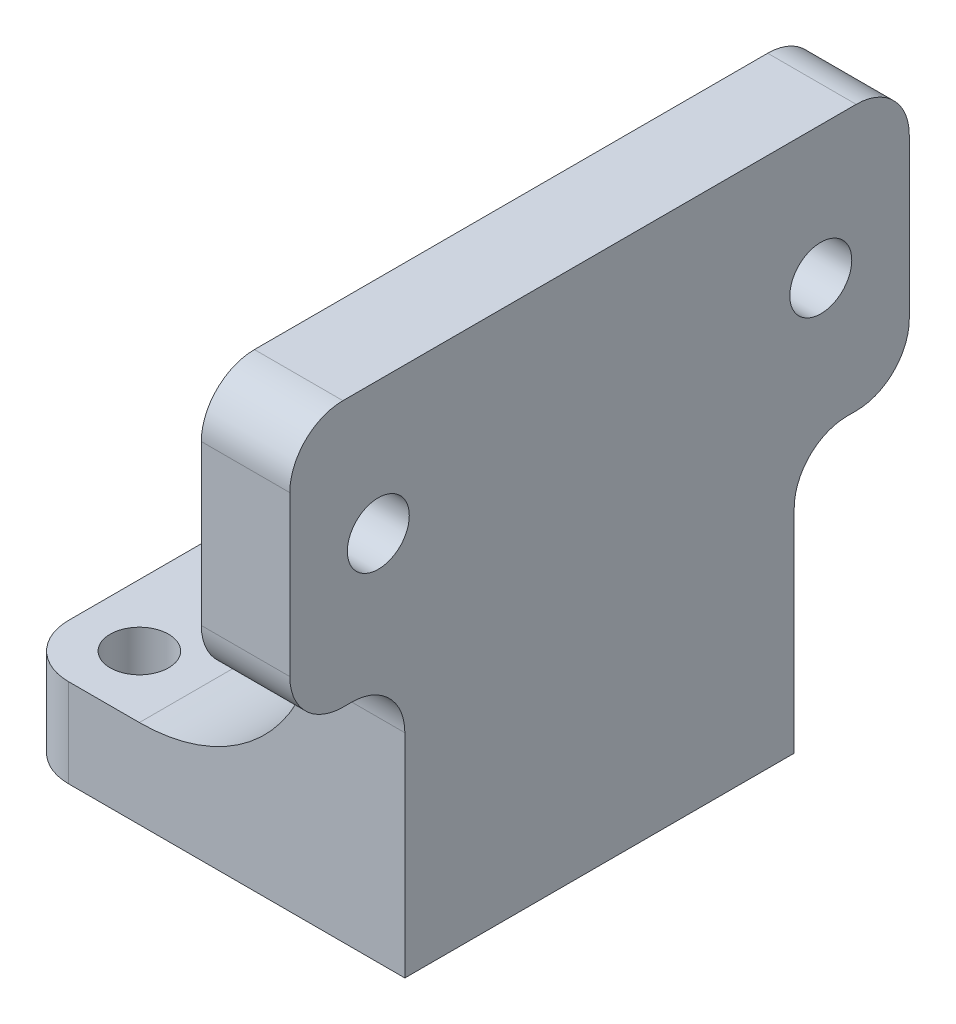
from build123d import *

# Parameters (mm, degrees)
SKETCH1_W                = 22
SKETCH1_H                = 22
SKETCH1_R                = 1.65
BOSS_EXTRUDE1_DEPTH      = 5
SKETCH2_W                = 5
SKETCH2_H                = 22
BOSS_EXTRUDE2_DEPTH      = 10
SKETCH3_W                = 7
SKETCH3_H                = 10
CUT_EXTRUDE1_DEPTH       = 0.1
FILLET1_R                = 10
SKETCH5_W                = 35
SKETCH5_H                = 15
SKETCH5_R                = 1.75
CHANGE_THIS_SKETCH_DEPTH = 5
FILLET2_R                = 3


with BuildPart() as part:
    # Sketch1 → Boss-Extrude1 (new body)
    with BuildSketch(Plane(origin=(0, 0, 0), x_dir=(1, 0, 0), z_dir=(0, 1, 0))):
        with Locations((11, 11)):
            Rectangle(SKETCH1_W, SKETCH1_H)
        with Locations(Location((13.5, 11, 0), (0, 0, 270))):
            Circle(SKETCH1_R, mode=Mode.SUBTRACT)
        with Locations(Location((3.5, 3.5, 0), (0, 0, 270))):
            Circle(SKETCH1_R, mode=Mode.SUBTRACT)
        with Locations(Location((3.5, 18.5, 0), (0, 0, 90))):
            Circle(SKETCH1_R, mode=Mode.SUBTRACT)
    extrude(amount=BOSS_EXTRUDE1_DEPTH)

    # Sketch2 → Boss-Extrude2 (add)
    with BuildSketch(Plane(origin=(0, 5, 0), x_dir=(1, 0, 0), z_dir=(0, 1, 0))):
        with Locations((19.5, 11)):
            Rectangle(SKETCH2_W, SKETCH2_H)
    extrude(amount=BOSS_EXTRUDE2_DEPTH)

    # Sketch3 → Cut-Extrude1 (cut)
    with BuildSketch(Plane.ZY.offset(-17)):
        with Locations((-11, 10)):
            Rectangle(SKETCH3_W, SKETCH3_H)
    extrude(amount=-CUT_EXTRUDE1_DEPTH, mode=Mode.SUBTRACT)

    # Fillet1
    fillet1_edges = [part.edges().sort_by_distance(p)[0] for p in [
        (17, 5, -18.25),
        (17, 5, -3.75),
    ]]
    fillet(fillet1_edges, radius=FILLET1_R - 0.0001)  # a hair under: the kernel refuses the full size

    # Sketch5 → CHANGE THIS SKETCH (add)
    with BuildSketch(Plane(origin=(22, 0, 0), x_dir=(0, 0, -1), z_dir=(1, 0, 0))):
        with Locations((11, 22.5)):
            Rectangle(SKETCH5_W, SKETCH5_H)
        with Locations((23.5, 22.5)):
            Circle(SKETCH5_R, mode=Mode.SUBTRACT)
        with Locations((-1.5, 22.5)):
            Circle(SKETCH5_R, mode=Mode.SUBTRACT)
    extrude(amount=-CHANGE_THIS_SKETCH_DEPTH)

    # Fillet2
    fillet2_edges = [part.edges().sort_by_distance(p)[0] for p in [
        (19.5, 15, -22),
        (19.5, 15, 0),
        (0, 2.5, -22),
        (19.5, 15, 6.5),
        (19.5, 30, 6.5),
        (19.5, 30, -28.5),
        (19.5, 15, -28.5),
        (0, 2.5, 0),
    ]]
    fillet(fillet2_edges, radius=FILLET2_R)


solid = part.part
